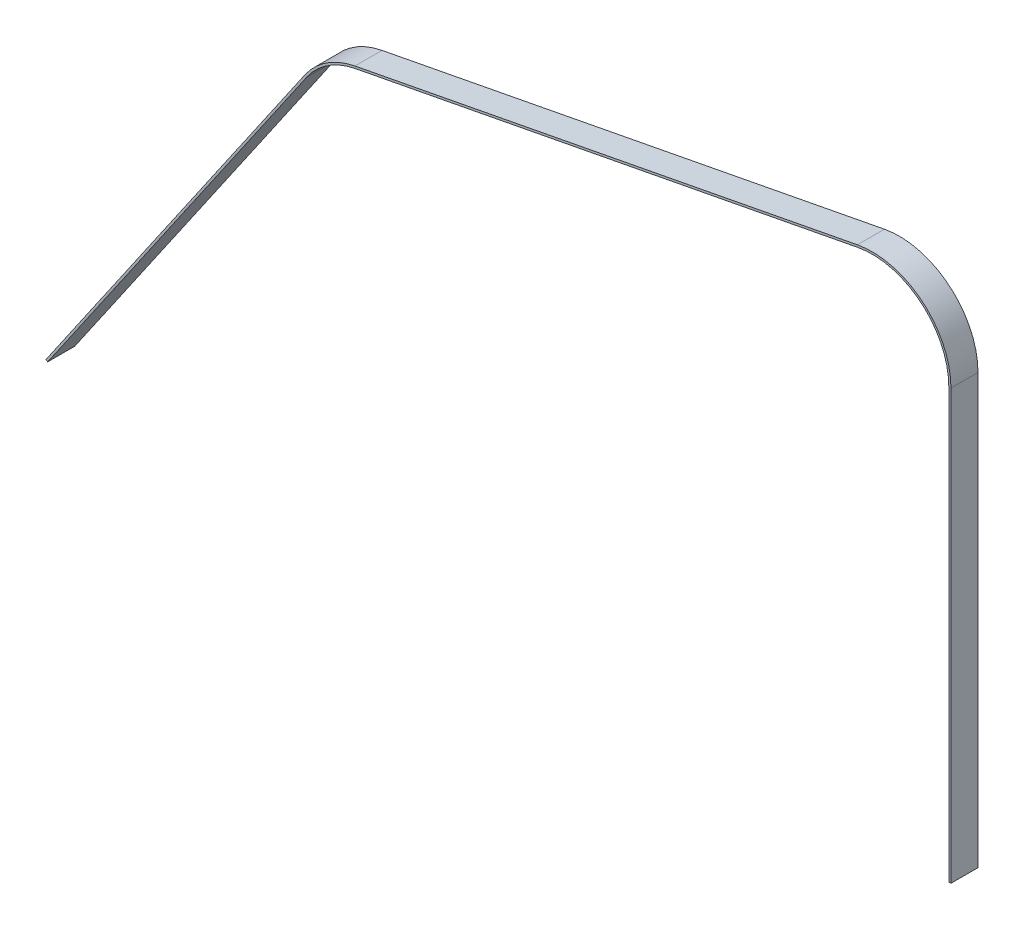
from build123d import *

# Parameters (mm, degrees)
BOSS_EXTRUDE1_DEPTH = 12.7


with BuildPart() as part:
    # Sketch1 → Boss-Extrude1 (new body)
    with BuildSketch(Plane.XY):
        with BuildLine():
            Line((229.016796431, 81.565078569), (-6.963180199, 36.305440914))
            ThreePointArc((-6.963180199, 36.305440914), (-20.215290066, 30.950169079), (-30.445288031, 20.967960206))
            Line((-30.445288031, 20.967960206), (-152.040439972, -155.587097497))
            Line((-152.040439972, -155.587097497), (-151.21686337, -156.154302557))
            Line((-151.21686337, -156.154302557), (-29.621711429, 20.400755146))
            ThreePointArc((-29.621711429, 20.400755146), (-19.668445514, 30.112934921), (-6.774818956, 35.323341102))
            Line((-6.774818956, 35.323341102), (229.205157674, 80.582978756))
            ThreePointArc((229.205157674, 80.582978756), (258.892479779, 72.984244016), (271.94713663, 45.259637654))
            Line((271.94713663, 45.259637654), (271.94713663, -156.154302557))
            Line((271.94713663, -156.154302557), (272.94713663, -156.154302557))
            Line((272.94713663, -156.154302557), (272.94713663, 45.259637654))
            ThreePointArc((272.94713663, 45.259637654), (259.529519322, 73.75507514), (229.016796431, 81.565078569))
        make_face()
    extrude(amount=BOSS_EXTRUDE1_DEPTH)


solid = part.part
